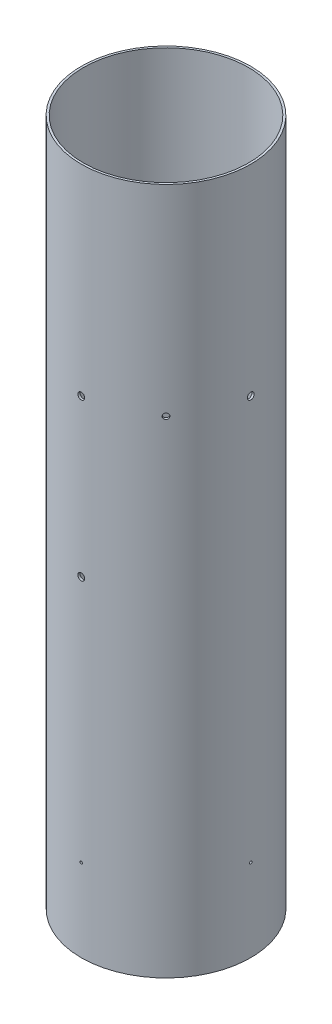
from build123d import *

# Parameters (mm, degrees)
SKETCH2_R                      = 78.359
SKETCH2_R_2                    = 76.3651
BOSS_EXTRUDE1_DEPTH            = 635
SKETCH3_R                      = 1.190625
CUT_EXTRUDE1_DEPTH             = 645.59697933
CIRPATTERN1_COUNT              = 4
SKETCH4_R                      = 3.175
CUT_EXTRUDE2_DEPTH             = 645.596979454
CIRPATTERN2_COUNT              = 4
CUT_EXTRUDE3_REACH             = 664.58
CUT_EXTRUDE3_END_RADIUS        = 76.3651
SKETCH5_R                      = 2.57937
CUT_EXTRUDE3_DIRECTION_2_DEPTH = 663.580045892
CUT_EXTRUDE4_DEPTH             = 645.596979454
CUT_EXTRUDE4_DEPTH_BACK        = 645.596979454
SKETCH6_R                      = 3.175


with BuildPart() as part:
    # Sketch2 → Boss-Extrude1 (new body)
    with BuildSketch(Plane(origin=(0, 0, 0), x_dir=(1, 0, 0), z_dir=(0, 1, 0))):
        Circle(SKETCH2_R)
        Circle(SKETCH2_R_2, mode=Mode.SUBTRACT)
    extrude(amount=BOSS_EXTRUDE1_DEPTH)

    # Sketch3 → Cut-Extrude1 (cut, symmetric)
    with BuildSketch(Plane.XY):
        with Locations((0, 76.2)):
            Circle(SKETCH3_R)
    cut_extrude1 = extrude(amount=CUT_EXTRUDE1_DEPTH, both=True, mode=Mode.SUBTRACT)

    # CirPattern1: Cut-Extrude1 ×4 about axis
    cirpattern1_axis = Axis((0, 635, 0), (0, 1, 0))
    for i in range(1, CIRPATTERN1_COUNT):
        add(cut_extrude1.rotate(cirpattern1_axis, i * 360 / CIRPATTERN1_COUNT), mode=Mode.SUBTRACT)

    # Sketch4 → Cut-Extrude2 (cut, symmetric)
    with BuildSketch(Plane.XY):
        with Locations((0, 449.5038)):
            Circle(SKETCH4_R)
    cut_extrude2 = extrude(amount=CUT_EXTRUDE2_DEPTH, both=True, mode=Mode.SUBTRACT)

    # CirPattern2: Cut-Extrude2 ×4 about axis
    cirpattern2_axis = Axis((0, 635, 0), (0, 1, 0))
    for i in range(1, CIRPATTERN2_COUNT):
        add(cut_extrude2.rotate(cirpattern2_axis, i * 360 / CIRPATTERN2_COUNT), mode=Mode.SUBTRACT)

    # Cut-Extrude3: up to this cylinder (the profile starts outside it)
    cut_extrude3_end = Plane(origin=(0, 449.5038, 0), z_dir=(0, -1, 0)) * Cylinder(CUT_EXTRUDE3_END_RADIUS, 1482.8902, mode=Mode.PRIVATE)
    # Sketch5 → Cut-Extrude3 (cut, up to the surface)
    with BuildSketch(Plane(origin=(55.408180267, 0, 55.408180267), x_dir=(0, -1, 0), z_dir=(0.7071067811865488, 0, 0.7071067811865464)), mode=Mode.PRIVATE) as cut_extrude3_sk1:
        with Locations((-449.5038, 0)):
            Circle(SKETCH5_R)
    cut_extrude3_tool1 = extrude(cut_extrude3_sk1.sketch, amount=-CUT_EXTRUDE3_REACH, mode=Mode.PRIVATE) - cut_extrude3_end
    add(cut_extrude3_tool1.solids().sort_by_distance((55.40818, 449.5038, 55.40818))[0], mode=Mode.SUBTRACT)

    # Sketch5 → Cut-Extrude3 direction 2 (cut)
    with BuildSketch(Plane(origin=(55.408180267, 0, 55.408180267), x_dir=(0, -1, 0), z_dir=(0.7071067811865488, 0, 0.7071067811865464))):
        with Locations((-449.5038, 0)):
            Circle(SKETCH5_R)
    extrude(amount=CUT_EXTRUDE3_DIRECTION_2_DEPTH, mode=Mode.SUBTRACT)

    # Sketch6 → Cut-Extrude4 (cut, two sides: drawn at the far end of the back side and taken through both)
    with BuildSketch(Plane.XY.offset(-CUT_EXTRUDE4_DEPTH_BACK)):
        with Locations((0, 304.8)):
            Circle(SKETCH6_R)
    extrude(amount=CUT_EXTRUDE4_DEPTH + CUT_EXTRUDE4_DEPTH_BACK, mode=Mode.SUBTRACT)


solid = part.part
